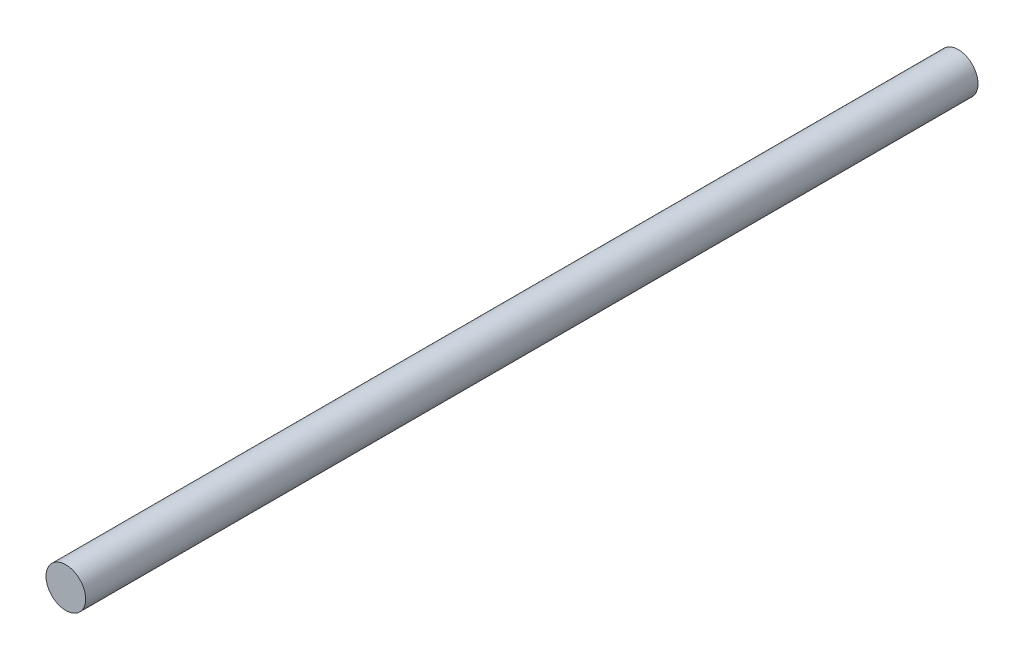
from build123d import *

# Parameters (mm, degrees)
SKETCH1_R           = 4
BOSS_EXTRUDE1_DEPTH = 180


with BuildPart() as part:
    # Sketch1 → Boss-Extrude1 (new body)
    with BuildSketch(Plane.XY):
        Circle(SKETCH1_R)
    extrude(amount=BOSS_EXTRUDE1_DEPTH)


solid = part.part
